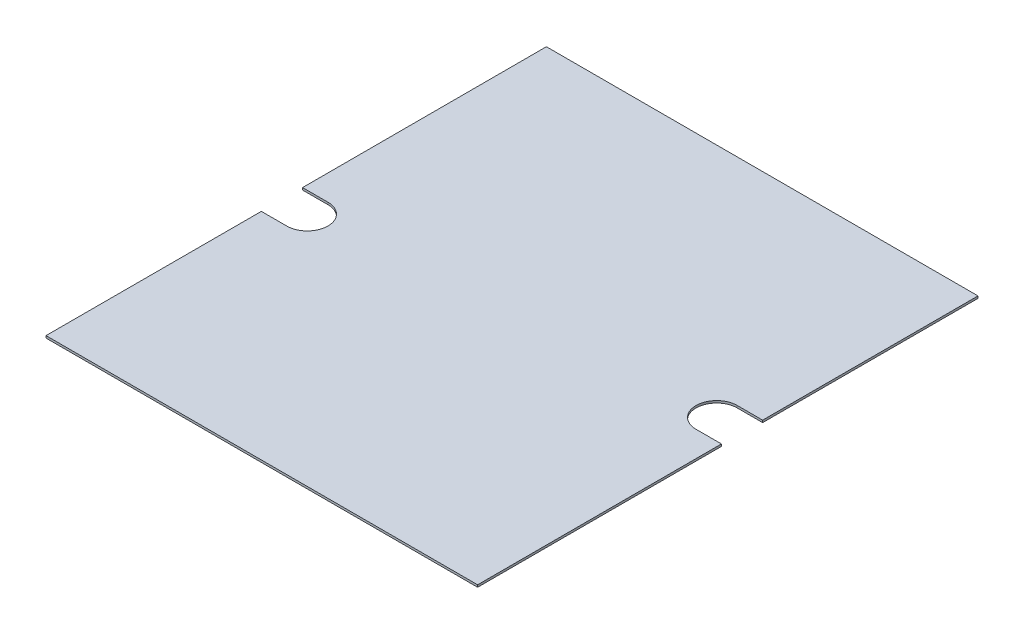
from build123d import *

# Parameters (mm, degrees)
BOSS_EXTRUDE1_DEPTH = 1


with BuildPart() as part:
    # Sketch1 → Boss-Extrude1 (new body)
    with BuildSketch(Plane(origin=(0, 0, 0), x_dir=(1, 0, 0), z_dir=(0, 1, 0))):
        with BuildLine():
            Line((0, 0), (199, 0))
            Line((199, 0), (198.959369161, 112.45))
            Line((198.959369161, 112.45), (187.25, 112.45))
            ThreePointArc((187.25, 112.45), (177.75, 121.95), (187.25, 131.45))
            Line((187.25, 131.45), (198.959369161, 131.45))
            Line((198.959369161, 131.45), (199, 230.7))
            Line((199, 230.7), (0, 230.7))
            Line((0, 230.7), (0.040630839, 118.25))
            Line((0.040630839, 118.25), (11.75, 118.25))
            ThreePointArc((11.75, 118.25), (21.25, 108.75), (11.75, 99.25))
            Line((11.75, 99.25), (0.040630839, 99.25))
            Line((0.040630839, 99.25), (0, 0))
        make_face()
    extrude(amount=BOSS_EXTRUDE1_DEPTH)


solid = part.part
